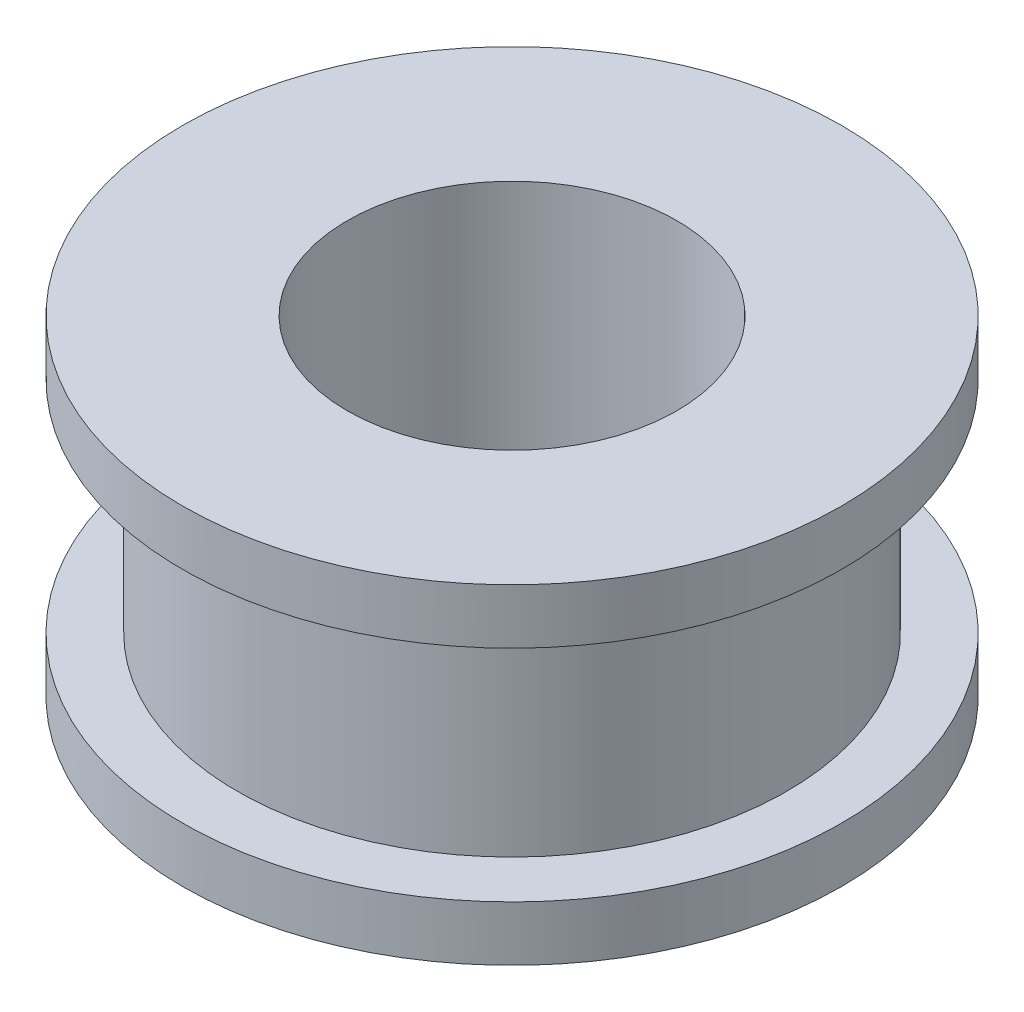
from build123d import *

# Parameters (mm, degrees)
SKETCH1_R           = 6
SKETCH1_R_2         = 3
BOSS_EXTRUDE1_DEPTH = 6
SKETCH2_W           = 1
SKETCH2_H           = 4


with BuildPart() as part:
    # Sketch1 → Boss-Extrude1 (new body)
    with BuildSketch(Plane(origin=(0, 0, 0), x_dir=(1, 0, 0), z_dir=(0, 1, 0))):
        Circle(SKETCH1_R)
        Circle(SKETCH1_R_2, mode=Mode.SUBTRACT)
    extrude(amount=BOSS_EXTRUDE1_DEPTH)

    # Sketch2 → Cut-Revolve1 (revolve, cut)
    with BuildSketch(Plane(origin=(0, 0, 0), x_dir=(0, 0, -1), z_dir=(1, 0, 0))):
        with Locations((5.5, 3)):
            Rectangle(SKETCH2_W, SKETCH2_H)
    revolve(axis=Axis((0, 0, 0), (0, 1, 0)), mode=Mode.SUBTRACT)


solid = part.part
